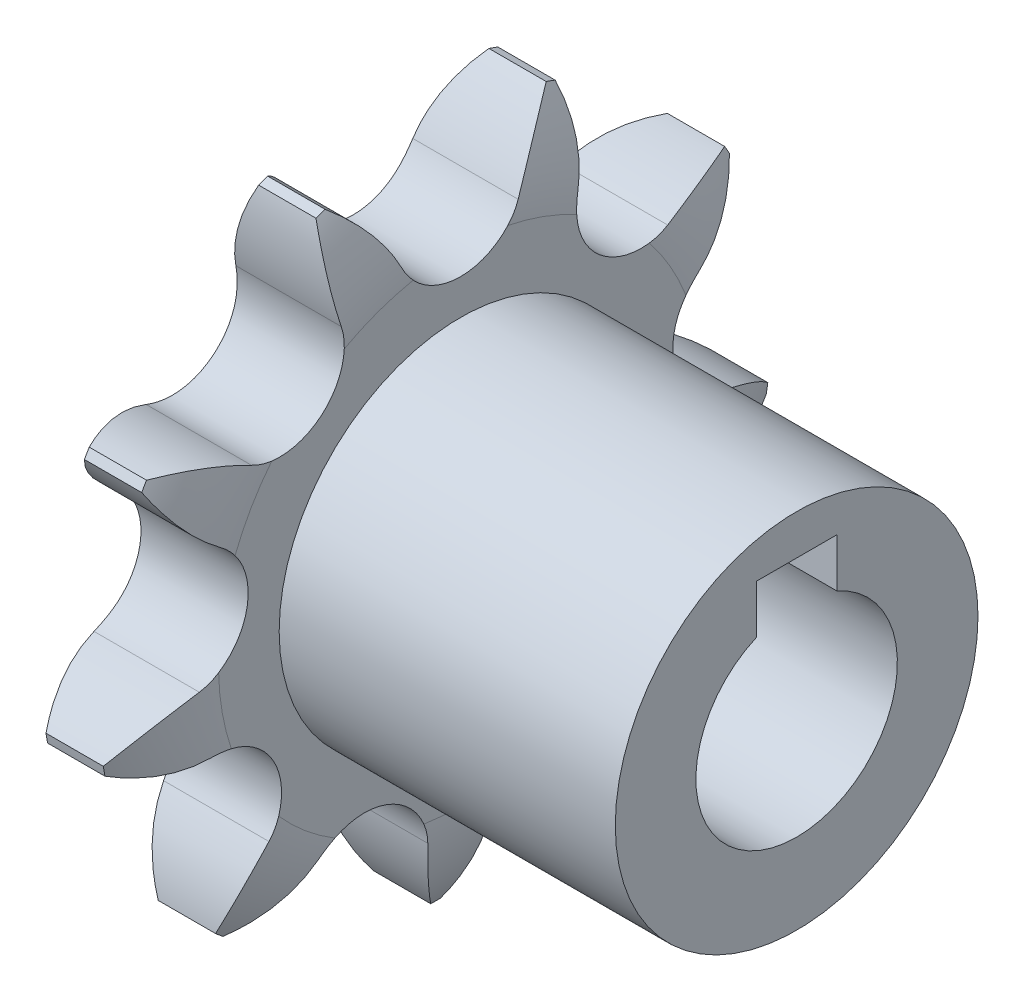
from build123d import *

# Parameters (mm, degrees)
TOOTHCUT_DEPTH      = 25.212835916
TEETHCUTS_COUNT     = 9
TEETHCUTS_ANGLE     = 320
BORSKE_R            = 5
BORE_DEPTH          = 50.0005
SKETCH1_R           = 9
SKETCH1_R_2         = 3
BOSS_EXTRUDE1_DEPTH = 16.6804
CUT_EXTRUDE1_START  = 24
SKETCH2_R           = 5
CUT_EXTRUDE1_DEPTH  = 24
CUT_EXTRUDE2_START  = -22
CUT_EXTRUDE2_DEPTH  = 22


# Read off the part's stored shape, not the designer's step: Cut-Extrude2
with BuildPart() as part:
    # BasProSke → Base-Revolve (revolve)
    with BuildSketch(Plane(origin=(0, 0, 0), x_dir=(1, 0, 0), z_dir=(0, 1, 0)), mode=Mode.PRIVATE) as base_revolve_sk:
        with BuildLine():
            Line((0, 0), (0, 12.006866982))
            ThreePointArc((0, 12.006866982), (0.314698702, 14.435029868), (1.238, 16.702743471))
            Line((1.238, 16.702743471), (4.0816, 16.702743471))
            ThreePointArc((4.0816, 16.702743471), (5.004901298, 14.435029868), (5.3196, 12.006866982))
            Line((5.3196, 12.006866982), (5.3196, 0))
            Line((5.3196, 0), (0, 0))
        make_face()
    revolve(base_revolve_sk.sketch.rotate(Axis((-10, 0, 0), (1, 0, 0)), 180), axis=Axis((-10, 0, 0), (1, 0, 0)))

    # TooCutSke → ToothCut (cut, through all)
    with BuildSketch(Plane(origin=(0, 0, 0), x_dir=(0, 0, -1), z_dir=(1, 0, 0))):
        with BuildLine():
            ThreePointArc((2.906302496, 12.60113736), (4.198990076, 14.583034398), (5.994051414, 16.124693193))
            ThreePointArc((5.994051414, 16.124693193), (0, 17.202743471), (-5.994051414, 16.124693193))
            ThreePointArc((-5.994051414, 16.124693193), (-4.198990076, 14.583034398), (-2.906302496, 12.60113736))
            ThreePointArc((-2.906302496, 12.60113736), (0, 10.749618471), (2.906302496, 12.60113736))
        make_face()
    toothcut = extrude(amount=TOOTHCUT_DEPTH, mode=Mode.SUBTRACT)

    # TeethCuts: ToothCut ×9 about axis
    teethcuts_axis = Axis((-10, 0, 0), (1, 0, 0))
    for i in range(1, TEETHCUTS_COUNT):
        add(toothcut.rotate(teethcuts_axis, i * TEETHCUTS_ANGLE / (TEETHCUTS_COUNT - 1)), mode=Mode.SUBTRACT)

    # BorSke → Bore (cut, symmetric)
    with BuildSketch(Plane(origin=(0, 0, 0), x_dir=(0, 0, -1), z_dir=(1, 0, 0))):
        with Locations(Location((0, 0, 0), (0, 0, 180))):
            Circle(BORSKE_R)
    extrude(amount=BORE_DEPTH, both=True, mode=Mode.SUBTRACT)

    # Sketch1 → Boss-Extrude1 (add)
    with BuildSketch(Plane(origin=(5.3196, 0, 0), x_dir=(0, 0, -1), z_dir=(1, 0, 0))):
        with Locations(Location((0, 0, 0), (0, 0, 180))):
            Circle(SKETCH1_R)
        Circle(SKETCH1_R_2, mode=Mode.SUBTRACT)
    extrude(amount=BOSS_EXTRUDE1_DEPTH)

    # Sketch2 → Cut-Extrude1 (cut)
    with BuildSketch(Plane(origin=(0, 0, 0), x_dir=(0, 0, -1), z_dir=(1, 0, 0)).offset(CUT_EXTRUDE1_START)):
        Circle(SKETCH2_R)
    extrude(amount=-CUT_EXTRUDE1_DEPTH, mode=Mode.SUBTRACT)

    # Cut-Extrude2 outline → Cut-Extrude2 (cut)
    with BuildSketch(Plane.ZY.offset(CUT_EXTRUDE2_START)):
        with BuildLine():
            Line((2, 4.582575695), (2, 7))
            Line((2, 7), (-2, 7))
            Line((-2, 7), (-2, 4.582575695))
            ThreePointArc((-2, 4.582575695), (0, 5), (2, 4.582575695))
        make_face()
    extrude(amount=CUT_EXTRUDE2_DEPTH, mode=Mode.SUBTRACT)


solid = part.part
